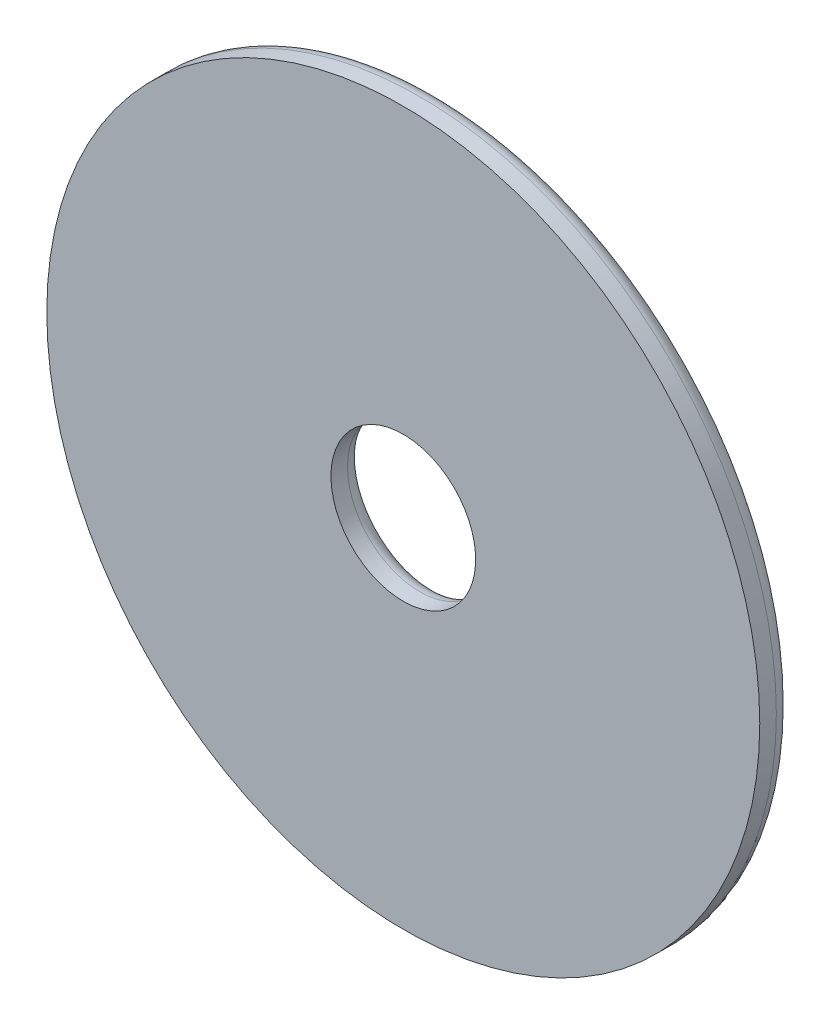
from build123d import *

# Parameters (mm, degrees)
BOSS_EXTRUDE1_DEPTH      = 0.59055
BOSS_EXTRUDE1_DEPTH_BACK = 0.59055
SKETCH3_R                = 12.7
SKETCH3_R_2              = 2.5781
FILLET1_R                = 0.59055


with BuildPart() as part:
    # Sketch3 → Boss-Extrude1 (new, two sides: drawn at the far end of the back side and taken through both)
    with BuildSketch(Plane.XY.offset(-BOSS_EXTRUDE1_DEPTH_BACK)):
        with Locations(Location((0, 0, 0), (0, 0, 180))):
            Circle(SKETCH3_R)
        with Locations(Location((0, 0, 0), (0, 0, 180))):
            Circle(SKETCH3_R_2, mode=Mode.SUBTRACT)
    extrude(amount=BOSS_EXTRUDE1_DEPTH + BOSS_EXTRUDE1_DEPTH_BACK)

    # Fillet1
    fillet1_edges = [part.edges().sort_by_distance(p)[0] for p in [
        (12.7, 0, -0.59055),
        (2.5781, 0, -0.59055),
    ]]
    fillet(fillet1_edges, radius=FILLET1_R - 0.0001)  # a hair under: the kernel refuses the full size


solid = part.part
